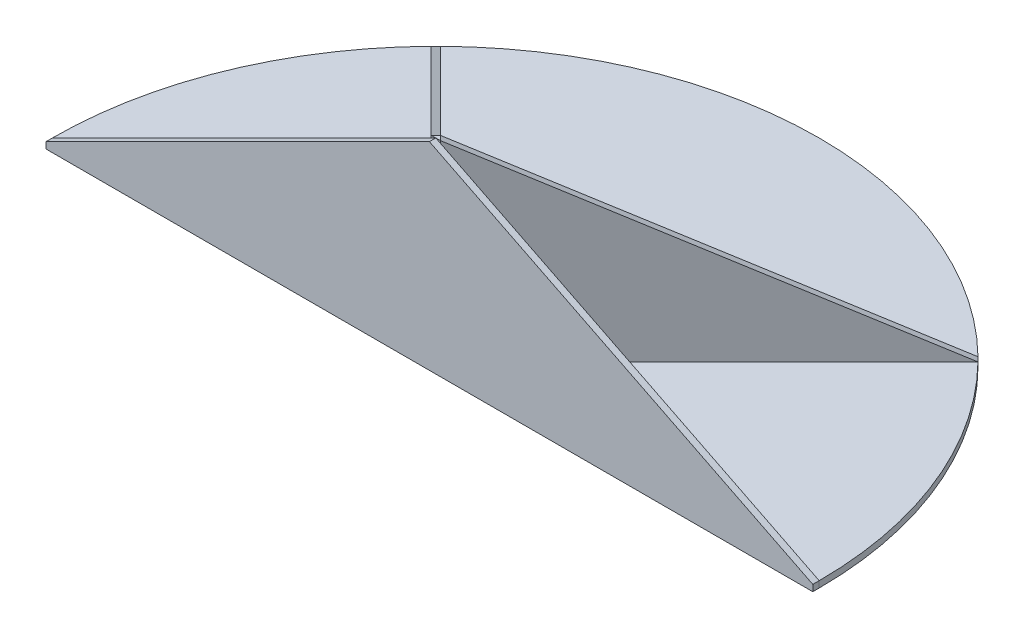
from build123d import *
from OCP.BRepAlgoAPI import BRepAlgoAPI_Cut
from OCP.TopTools import TopTools_ListOfShape

# Parameters (mm, degrees)
SALIENTE_EXTRUIR1_DEPTH = 5
SALIENTE_EXTRUIR2_DEPTH = 5
SALIENTE_EXTRUIR3_DEPTH = 150
CORTAR_EXTRUIR1_REACH   = 655.84
CORTAR_EXTRUIR2_REACH   = 499.984
CORTAR_EXTRUIR3_REACH   = 538.214
CROQUIS6_W              = 4.999913194
CROQUIS6_H              = 150
CORTAR_EXTRUIR4_DEPTH   = 150
CROQUIS8_R              = 5
CORTAR_EXTRUIR5_DEPTH   = 5


with BuildPart() as part:
    # Croquis1 → Saliente-Extruir1 (new body)
    with BuildSketch(Plane(origin=(0, 0, 0), x_dir=(1, 0, 0), z_dir=(0, 1, 0))):
        with BuildLine():
            Line((0, 0), (600, 0))
            ThreePointArc((600, 0), (300, 300), (0, 0))
        make_face()
    extrude(amount=-SALIENTE_EXTRUIR1_DEPTH)

    # Croquis2 → Saliente-Extruir2 (add)
    with BuildSketch(Plane.XY):
        Polygon((300, 150), (600, 0), (600, -5), (0, -5), (0, 0), align=None)
    extrude(amount=SALIENTE_EXTRUIR2_DEPTH)

    # Croquis3 → Saliente-Extruir3 (add)
    with BuildSketch(Plane(origin=(0, 0, 0), x_dir=(1, 0, 0), z_dir=(0, 1, 0))):
        Polygon((89.643082947, 213.892420268), (87.767304207, 212.03132513), (86.007761026, 210.255372485), (296.263133511, 0), (300, 0), (303.535503215, 0), (300, 3.535503215), align=None)
        Polygon((510.356917053, 213.892420268), (300, 3.535503215), (303.535503215, 0), (513.892420268, 210.356917053), (512.132034356, 212.132034356), align=None)
    extrude(amount=SALIENTE_EXTRUIR3_DEPTH)

    # Croquis4 → Cortar-Extruir1 (cut, up to next)
    with BuildSketch(Plane(origin=(148.232248392, 0, 148.232248392), x_dir=(-0.7071067811865465, 0, 0.7071067811865487), z_dir=(-0.7071067811865487, 0, -0.7071067811865465)), mode=Mode.PRIVATE) as cortar_extruir1_sk1:
        Polygon((-214.632012654, 150), (-512.121617689, 0), (-512.121617689, 150), align=None)
    cortar_extruir1_tool1 = extrude(cortar_extruir1_sk1.sketch, amount=-CORTAR_EXTRUIR1_REACH, mode=Mode.PRIVATE) & part.part
    add(cortar_extruir1_tool1.solids().sort_by_distance((440.237945, 100, -143.773448))[0], mode=Mode.SUBTRACT)

    # Croquis5 → Cortar-Extruir2 (cut, up to next)
    with BuildSketch(Plane(origin=(151.767751608, 0, -151.767751608), x_dir=(-0.7071067811865488, 0, -0.7071067811865464), z_dir=(0.7071067811865464, 0, -0.7071067811865488)), mode=Mode.PRIVATE) as cortar_extruir2_sk1:
        Polygon((-209.632056057, 150), (87.857548977, 0), (87.857548977, 150), align=None)
    cortar_extruir2_tool1 = extrude(cortar_extruir2_sk1.sketch, amount=-CORTAR_EXTRUIR2_REACH, mode=Mode.PRIVATE) & part.part
    add(cortar_extruir2_tool1.solids().sort_by_distance((159.762055, 100, -143.773448))[0], mode=Mode.SUBTRACT)

    # Croquis6 → Cortar-Extruir3 (cut, up to next)
    with BuildSketch(Plane(origin=(359.994486555, 0, -363.007018979), x_dir=(-0.7100469213351532, 0, -0.7041543648252638), z_dir=(0.7041543648252638, 0, -0.7100469213351532)), mode=Mode.PRIVATE) as cortar_extruir3_sk1:
        with Locations((-214.264032998, 75)):
            Rectangle(CROQUIS6_W, CROQUIS6_H)
    cortar_extruir3_tool1 = extrude(cortar_extruir3_sk1.sketch, amount=-CORTAR_EXTRUIR3_REACH, mode=Mode.PRIVATE) & part.part
    add(cortar_extruir3_tool1.solids().sort_by_distance((512.132004, 75, -212.132065))[0], mode=Mode.SUBTRACT)


with BuildPart() as cortar_extruir4_tool:
    # Cortar-Extruir4: read off the stored shape, not the designer's step
    # Cortar-Extruir4 outline → Cortar-Extruir4 (new body)
    with BuildSketch(Plane(origin=(0, 0, 0), x_dir=(1, 0, 0), z_dir=(0, 1, 0))):
        Polygon((87.767304207, 212.03132513), (86.192818289, 210.442155589), (89.643082947, 213.892420268), align=None)
    extrude(amount=CORTAR_EXTRUIR4_DEPTH)


with BuildPart() as part_1:
    add(part.part)

    # Cortar-Extruir4: cut by cortar_extruir4_tool, with a tolerance
    cortar_extruir4_stock = TopTools_ListOfShape()
    cortar_extruir4_stock.Append(part_1.part.wrapped)
    cortar_extruir4_tools = TopTools_ListOfShape()
    cortar_extruir4_tools.Append(cortar_extruir4_tool.part.wrapped)
    cortar_extruir4_cut = BRepAlgoAPI_Cut()
    cortar_extruir4_cut.SetArguments(cortar_extruir4_stock)
    cortar_extruir4_cut.SetTools(cortar_extruir4_tools)
    cortar_extruir4_cut.SetFuzzyValue(0.00001)
    cortar_extruir4_cut.Build()
    add(Compound.cast(cortar_extruir4_cut.Shape()).solids(), mode=Mode.REPLACE)

    # Croquis8 → Cortar-Extruir5 (cut)
    with BuildSketch(Plane.XZ.offset(5)):
        with Locations(Location((300, -15, 0), (0, 0, 270))):
            Circle(CROQUIS8_R)
    extrude(amount=-CORTAR_EXTRUIR5_DEPTH, mode=Mode.SUBTRACT)


solid = part_1.part
